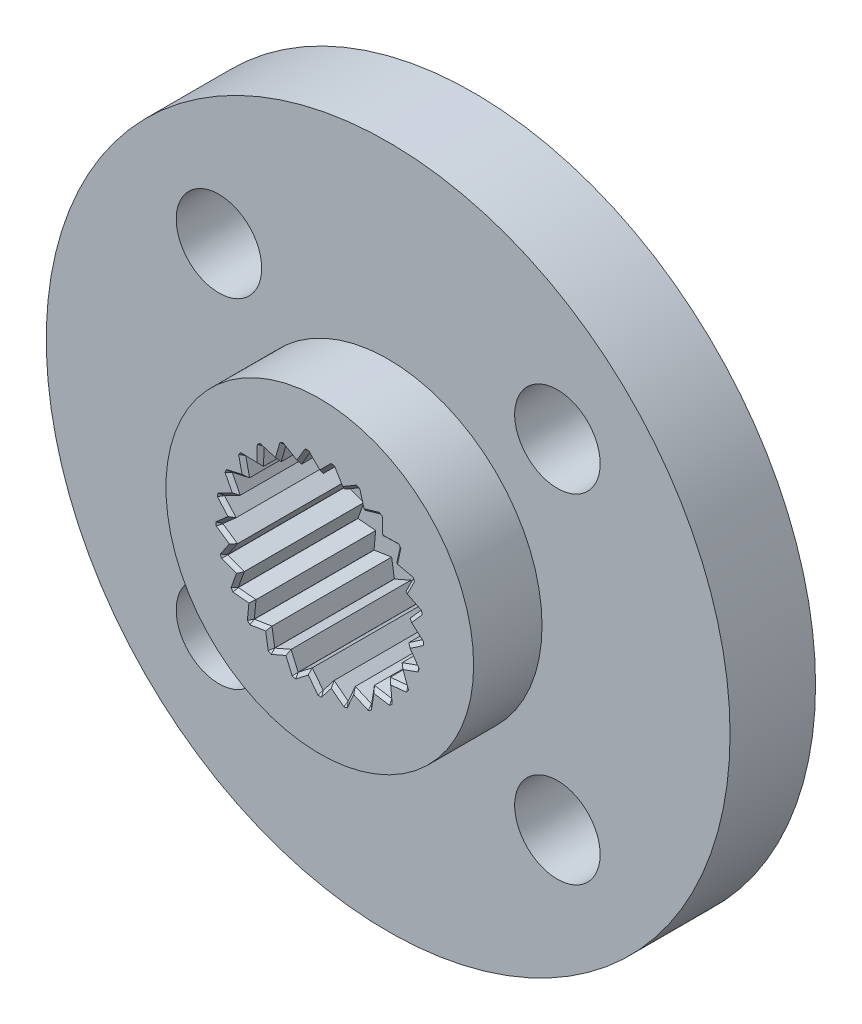
from build123d import *

# Parameters (mm, degrees)
SKETCH_1_R          = 10
SKETCH_1_R_2        = 1.25
SKETCH_1_R_3        = 1.5
EXTRUDE_1_DEPTH     = 2.5
SKETCH_2_R          = 4.5
SKETCH_2_R_2        = 1.5
EXTRUDE_2_DEPTH     = 2
CUT_EXTRUDE_START   = -3.6
SKETCH_3_R          = 1.5
CUT_EXTRUDE_1_DEPTH = 3.6
CHAMFER_1_SIZE      = 0.1


with BuildPart() as part:
    # 草图1 → 凸台-拉伸1 (new body)
    with BuildSketch(Plane.XY):
        Circle(SKETCH_1_R)
        with Locations((-4.949747468, 4.949747468)):
            Circle(SKETCH_1_R_2, mode=Mode.SUBTRACT)
        with Locations((4.949747468, 4.949747468)):
            Circle(SKETCH_1_R_2, mode=Mode.SUBTRACT)
        with Locations((4.949747468, -4.949747468)):
            Circle(SKETCH_1_R_2, mode=Mode.SUBTRACT)
        with Locations((-4.949747468, -4.949747468)):
            Circle(SKETCH_1_R_2, mode=Mode.SUBTRACT)
        Circle(SKETCH_1_R_3, mode=Mode.SUBTRACT)
    extrude(amount=EXTRUDE_1_DEPTH)

    # 草图2 → 凸台-拉伸2 (add)
    with BuildSketch(Plane.XY.offset(2.5)):
        Circle(SKETCH_2_R)
        Circle(SKETCH_2_R_2, mode=Mode.SUBTRACT)
    extrude(amount=EXTRUDE_2_DEPTH)

    # 草图3 → 切除-拉伸1 (cut)
    with BuildSketch(Plane.XY.offset(4.5).offset(CUT_EXTRUDE_START)):
        with BuildLine():
            Line((0.366495157, 2.916495157), (0, 2.55))
            Line((0, 2.55), (-0.366495157, 2.916495157))
            ThreePointArc((-0.366495157, 2.916495157), (-0.368408565, 2.916254075), (-0.370321814, 2.916011738))
            Line((-0.370321814, 2.916011738), (-0.634159212, 2.469887061))
            Line((-0.634159212, 2.469887061), (-1.080283889, 2.733724459))
            ThreePointArc((-1.080283889, 2.733724459), (-1.082077229, 2.733015106), (-1.083870103, 2.732304577))
            Line((-1.083870103, 2.732304577), (-1.228471869, 2.234582034))
            Line((-1.228471869, 2.234582034), (-1.726194412, 2.3791838))
            ThreePointArc((-1.726194412, 2.3791838), (-1.727755001, 2.378050747), (-1.729314848, 2.37691667))
            Line((-1.729314848, 2.37691667), (-1.74559512, 1.85887))
            Line((-1.74559512, 1.85887), (-2.263641791, 1.875150272))
            ThreePointArc((-2.263641791, 1.875150272), (-2.264871573, 1.873664714), (-2.26610038, 1.872178348))
            Line((-2.26610038, 1.872178348), (-2.15303621, 1.366358327))
            Line((-2.15303621, 1.366358327), (-2.658856231, 1.253294157))
            ThreePointArc((-2.658856231, 1.253294157), (-2.659677934, 1.251549435), (-2.660498492, 1.249804175))
            Line((-2.660498492, 1.249804175), (-2.425194117, 0.787993336))
            Line((-2.425194117, 0.787993336), (-2.887004956, 0.55268896))
            ThreePointArc((-2.887004956, 0.55268896), (-2.887366949, 0.550794703), (-2.887727699, 0.548900209))
            Line((-2.887727699, 0.548900209), (-2.544968157, 0.160115825))
            Line((-2.544968157, 0.160115825), (-2.933752541, -0.182643716))
            ThreePointArc((-2.933752541, -0.182643716), (-2.933632079, -0.184568486), (-2.933510354, -0.186493176))
            Line((-2.933510354, -0.186493176), (-2.504832489, -0.477822352))
            Line((-2.504832489, -0.477822352), (-2.796161665, -0.906500217))
            ThreePointArc((-2.796161665, -0.906500217), (-2.795566317, -0.908334558), (-2.794969765, -0.910168509))
            Line((-2.794969765, -0.910168509), (-2.307308984, -1.085737193))
            Line((-2.307308984, -1.085737193), (-2.482877668, -1.573397974))
            ThreePointArc((-2.482877668, -1.573397974), (-2.481844841, -1.57502663), (-2.480810946, -1.576654607))
            Line((-2.480810946, -1.576654607), (-1.964808769, -1.625431174))
            Line((-1.964808769, -1.625431174), (-2.013585336, -2.141433351))
            ThreePointArc((-2.013585336, -2.141433351), (-2.012179927, -2.142753985), (-2.010773652, -2.144073698))
            Line((-2.010773652, -2.144073698), (-1.498852393, -2.062993336))
            Line((-1.498852393, -2.062993336), (-1.417772031, -2.574914594))
            ThreePointArc((-1.417772031, -2.574914594), (-1.416082348, -2.575844228), (-1.414392054, -2.576772752))
            Line((-1.414392054, -2.576772752), (-0.938717609, -2.370930039))
            Line((-0.938717609, -2.370930039), (-0.732874896, -2.846604484))
            ThreePointArc((-0.732874896, -2.846604484), (-0.731007106, -2.847084704), (-0.729139002, -2.847563698))
            Line((-0.729139002, -2.847563698), (-0.319599746, -2.529892488))
            Line((-0.319599746, -2.529892488), (-0.001928536, -2.939431745))
            ThreePointArc((-0.001928536, -2.939431745), (0, -2.939432377), (0.001928536, -2.939431745))
            Line((0.001928536, -2.939431745), (0.319599746, -2.529892488))
            Line((0.319599746, -2.529892488), (0.729139002, -2.847563698))
            ThreePointArc((0.729139002, -2.847563698), (0.731007106, -2.847084704), (0.732874896, -2.846604484))
            Line((0.732874896, -2.846604484), (0.938717609, -2.370930039))
            Line((0.938717609, -2.370930039), (1.414392054, -2.576772752))
            ThreePointArc((1.414392054, -2.576772752), (1.416082348, -2.575844228), (1.417772031, -2.574914594))
            Line((1.417772031, -2.574914594), (1.498852393, -2.062993336))
            Line((1.498852393, -2.062993336), (2.010773652, -2.144073698))
            ThreePointArc((2.010773652, -2.144073698), (2.012179927, -2.142753985), (2.013585336, -2.141433351))
            Line((2.013585336, -2.141433351), (1.964808769, -1.625431174))
            Line((1.964808769, -1.625431174), (2.480810946, -1.576654607))
            ThreePointArc((2.480810946, -1.576654607), (2.481844841, -1.57502663), (2.482877668, -1.573397974))
            Line((2.482877668, -1.573397974), (2.307308984, -1.085737193))
            Line((2.307308984, -1.085737193), (2.794969765, -0.910168509))
            ThreePointArc((2.794969765, -0.910168509), (2.795566317, -0.908334558), (2.796161665, -0.906500217))
            Line((2.796161665, -0.906500217), (2.504832489, -0.477822352))
            Line((2.504832489, -0.477822352), (2.933510354, -0.186493176))
            ThreePointArc((2.933510354, -0.186493176), (2.933632079, -0.184568486), (2.933752541, -0.182643716))
            Line((2.933752541, -0.182643716), (2.544968157, 0.160115825))
            Line((2.544968157, 0.160115825), (2.887727699, 0.548900209))
            ThreePointArc((2.887727699, 0.548900209), (2.887366949, 0.550794703), (2.887004956, 0.55268896))
            Line((2.887004956, 0.55268896), (2.425194117, 0.787993336))
            Line((2.425194117, 0.787993336), (2.660498492, 1.249804175))
            ThreePointArc((2.660498492, 1.249804175), (2.659677934, 1.251549435), (2.658856231, 1.253294157))
            Line((2.658856231, 1.253294157), (2.15303621, 1.366358327))
            Line((2.15303621, 1.366358327), (2.26610038, 1.872178348))
            ThreePointArc((2.26610038, 1.872178348), (2.264871573, 1.873664714), (2.263641791, 1.875150272))
            Line((2.263641791, 1.875150272), (1.74559512, 1.85887))
            Line((1.74559512, 1.85887), (1.729314848, 2.37691667))
            ThreePointArc((1.729314848, 2.37691667), (1.727755001, 2.378050747), (1.726194412, 2.3791838))
            Line((1.726194412, 2.3791838), (1.228471869, 2.234582034))
            Line((1.228471869, 2.234582034), (1.083870103, 2.732304577))
            ThreePointArc((1.083870103, 2.732304577), (1.082077229, 2.733015106), (1.080283889, 2.733724459))
            Line((1.080283889, 2.733724459), (0.634159212, 2.469887061))
            Line((0.634159212, 2.469887061), (0.370321814, 2.916011738))
            ThreePointArc((0.370321814, 2.916011738), (0.368408565, 2.916254075), (0.366495157, 2.916495157))
        make_face()
        Circle(SKETCH_3_R, mode=Mode.SUBTRACT)
    extrude(amount=CUT_EXTRUDE_1_DEPTH, mode=Mode.SUBTRACT)

    # 倒角1
    chamfer_1_edges = [part.edges().sort_by_distance(p)[0] for p in [
        (-2.719171422, -0.332157764, 4.5),
    ]]
    chamfer(chamfer_1_edges, length=CHAMFER_1_SIZE)
    chamfer_1_2_edges = [part.edges().sort_by_distance(p)[0] for p in [
        (-2.678601246, -0.733515313, 4.5),
    ]]
    chamfer(chamfer_1_2_edges, length=CHAMFER_1_SIZE)
    chamfer_1_3_edges = [part.edges().sort_by_distance(p)[0] for p in [
        (-2.551139374, -0.997952851, 4.5),
    ]]
    chamfer(chamfer_1_3_edges, length=CHAMFER_1_SIZE)
    chamfer_1_4_edges = [part.edges().sort_by_distance(p)[0] for p in [
        (-2.412030222, -1.376611622, 4.5),
    ]]
    chamfer(chamfer_1_4_edges, length=CHAMFER_1_SIZE)
    chamfer_1_5_edges = [part.edges().sort_by_distance(p)[0] for p in [
        (-2.222809858, -1.601042891, 4.5),
    ]]
    chamfer(chamfer_1_5_edges, length=CHAMFER_1_SIZE)
    chamfer_1_6_edges = [part.edges().sort_by_distance(p)[0] for p in [
        (-1.993902468, -1.933210361, 4.5),
    ]]
    chamfer(chamfer_1_6_edges, length=CHAMFER_1_SIZE)
    chamfer_1_7_edges = [part.edges().sort_by_distance(p)[0] for p in [
        (-1.754813023, -2.103533517, 4.5),
    ]]
    chamfer(chamfer_1_7_edges, length=CHAMFER_1_SIZE)
    chamfer_1_8_edges = [part.edges().sort_by_distance(p)[0] for p in [
        (-1.450490489, -2.368338382, 4.5),
    ]]
    chamfer(chamfer_1_8_edges, length=CHAMFER_1_SIZE)
    chamfer_1_9_edges = [part.edges().sort_by_distance(p)[0] for p in [
        (-1.176554832, -2.473851396, 4.5),
    ]]
    chamfer(chamfer_1_9_edges, length=CHAMFER_1_SIZE)
    chamfer_1_10_edges = [part.edges().sort_by_distance(p)[0] for p in [
        (-0.815938858, -2.654654993, 4.5),
    ]]
    chamfer(chamfer_1_10_edges, length=CHAMFER_1_SIZE)
    chamfer_1_11_edges = [part.edges().sort_by_distance(p)[0] for p in [
        (-0.524369374, -2.688728093, 4.5),
    ]]
    chamfer(chamfer_1_11_edges, length=CHAMFER_1_SIZE)
    chamfer_1_12_edges = [part.edges().sort_by_distance(p)[0] for p in [
        (-0.130118788, -2.774169867, 4.5),
    ]]
    chamfer(chamfer_1_12_edges, length=CHAMFER_1_SIZE)
    chamfer_1_13_edges = [part.edges().sort_by_distance(p)[0] for p in [
        (0.160764141, -2.734662116, 4.5),
    ]]
    chamfer(chamfer_1_13_edges, length=CHAMFER_1_SIZE)
    chamfer_1_14_edges = [part.edges().sort_by_distance(p)[0] for p in [
        (0.563877124, -2.719373446, 4.5),
    ]]
    chamfer(chamfer_1_14_edges, length=CHAMFER_1_SIZE)
    chamfer_1_15_edges = [part.edges().sort_by_distance(p)[0] for p in [
        (0.835796253, -2.608767261, 4.5),
    ]]
    chamfer(chamfer_1_15_edges, length=CHAMFER_1_SIZE)
    chamfer_1_16_edges = [part.edges().sort_by_distance(p)[0] for p in [
        (1.222442563, -2.49370879, 4.5),
    ]]
    chamfer(chamfer_1_16_edges, length=CHAMFER_1_SIZE)
    chamfer_1_17_edges = [part.edges().sort_by_distance(p)[0] for p in [
        (1.458312212, -2.318953965, 4.5),
    ]]
    chamfer(chamfer_1_17_edges, length=CHAMFER_1_SIZE)
    chamfer_1_18_edges = [part.edges().sort_by_distance(p)[0] for p in [
        (1.80419744, -2.11135524, 4.5),
    ]]
    chamfer(chamfer_1_18_edges, length=CHAMFER_1_SIZE)
    chamfer_1_19_edges = [part.edges().sort_by_distance(p)[0] for p in [
        (1.989197052, -1.883432262, 4.5),
    ]]
    chamfer(chamfer_1_19_edges, length=CHAMFER_1_SIZE)
    chamfer_1_20_edges = [part.edges().sort_by_distance(p)[0] for p in [
        (2.272587956, -1.596337475, 4.5),
    ]]
    chamfer(chamfer_1_20_edges, length=CHAMFER_1_SIZE)
    chamfer_1_21_edges = [part.edges().sort_by_distance(p)[0] for p in [
        (2.395093326, -1.329567584, 4.5),
    ]]
    chamfer(chamfer_1_21_edges, length=CHAMFER_1_SIZE)
    chamfer_1_22_edges = [part.edges().sort_by_distance(p)[0] for p in [
        (2.598183413, -0.981015955, 4.5),
    ]]
    chamfer(chamfer_1_22_edges, length=CHAMFER_1_SIZE)
    chamfer_1_23_edges = [part.edges().sort_by_distance(p)[0] for p in [
        (2.650497077, -0.692161284, 4.5),
    ]]
    chamfer(chamfer_1_23_edges, length=CHAMFER_1_SIZE)
    chamfer_1_24_edges = [part.edges().sort_by_distance(p)[0] for p in [
        (2.76052545, -0.304053595, 4.5),
    ]]
    chamfer(chamfer_1_24_edges, length=CHAMFER_1_SIZE)
    chamfer_1_25_edges = [part.edges().sort_by_distance(p)[0] for p in [
        (2.739360349, -0.011263946, 4.5),
    ]]
    chamfer(chamfer_1_25_edges, length=CHAMFER_1_SIZE)
    chamfer_1_26_edges = [part.edges().sort_by_distance(p)[0] for p in [
        (2.749413521, 0.39201357, 4.5),
    ]]
    chamfer(chamfer_1_26_edges, length=CHAMFER_1_SIZE)
    chamfer_1_27_edges = [part.edges().sort_by_distance(p)[0] for p in [
        (2.656099536, 0.670341148, 4.5),
    ]]
    chamfer(chamfer_1_27_edges, length=CHAMFER_1_SIZE)
    chamfer_1_28_edges = [part.edges().sort_by_distance(p)[0] for p in [
        (2.565545829, 1.063449081, 4.5),
    ]]
    chamfer(chamfer_1_28_edges, length=CHAMFER_1_SIZE)
    chamfer_1_29_edges = [part.edges().sort_by_distance(p)[0] for p in [
        (2.40594622, 1.309826242, 4.5),
    ]]
    chamfer(chamfer_1_29_edges, length=CHAMFER_1_SIZE)
    chamfer_1_30_edges = [part.edges().sort_by_distance(p)[0] for p in [
        (2.220475457, 1.668064176, 4.5),
    ]]
    chamfer(chamfer_1_30_edges, length=CHAMFER_1_SIZE)
    chamfer_1_31_edges = [part.edges().sort_by_distance(p)[0] for p in [
        (2.004618455, 1.867010136, 4.5),
    ]]
    chamfer(chamfer_1_31_edges, length=CHAMFER_1_SIZE)
    chamfer_1_32_edges = [part.edges().sort_by_distance(p)[0] for p in [
        (1.735884446, 2.167868663, 4.5),
    ]]
    chamfer(chamfer_1_32_edges, length=CHAMFER_1_SIZE)
    chamfer_1_33_edges = [part.edges().sort_by_distance(p)[0] for p in [
        (1.47733314, 2.306882917, 4.5),
    ]]
    chamfer(chamfer_1_33_edges, length=CHAMFER_1_SIZE)
    chamfer_1_34_edges = [part.edges().sort_by_distance(p)[0] for p in [
        (1.142221431, 2.53145799, 4.5),
    ]]
    chamfer(chamfer_1_34_edges, length=CHAMFER_1_SIZE)
    chamfer_1_35_edges = [part.edges().sort_by_distance(p)[0] for p in [
        (0.857221551, 2.60180576, 4.5),
    ]]
    chamfer(chamfer_1_35_edges, length=CHAMFER_1_SIZE)
    chamfer_1_36_edges = [part.edges().sort_by_distance(p)[0] for p in [
        (0.476788442, 2.735986501, 4.5),
    ]]
    chamfer(chamfer_1_36_edges, length=CHAMFER_1_SIZE)
    chamfer_1_37_edges = [part.edges().sort_by_distance(p)[0] for p in [
        (0.183247578, 2.733247578, 4.5),
    ]]
    chamfer(chamfer_1_37_edges, length=CHAMFER_1_SIZE)
    chamfer_1_38_edges = [part.edges().sort_by_distance(p)[0] for p in [
        (-0.218602918, 2.768602918, 4.5),
    ]]
    chamfer(chamfer_1_38_edges, length=CHAMFER_1_SIZE)
    chamfer_1_39_edges = [part.edges().sort_by_distance(p)[0] for p in [
        (-0.502240513, 2.692949399, 4.5),
    ]]
    chamfer(chamfer_1_39_edges, length=CHAMFER_1_SIZE)
    chamfer_1_40_edges = [part.edges().sort_by_distance(p)[0] for p in [
        (-0.900258652, 2.627257831, 4.5),
    ]]
    chamfer(chamfer_1_40_edges, length=CHAMFER_1_SIZE)
    chamfer_1_41_edges = [part.edges().sort_by_distance(p)[0] for p in [
        (-1.156170986, 2.483443305, 4.5),
    ]]
    chamfer(chamfer_1_41_edges, length=CHAMFER_1_SIZE)
    chamfer_1_42_edges = [part.edges().sort_by_distance(p)[0] for p in [
        (-1.525347825, 2.320832472, 4.5),
    ]]
    chamfer(chamfer_1_42_edges, length=CHAMFER_1_SIZE)
    chamfer_1_43_edges = [part.edges().sort_by_distance(p)[0] for p in [
        (-1.737454984, 2.117893335, 4.5),
    ]]
    chamfer(chamfer_1_43_edges, length=CHAMFER_1_SIZE)
    chamfer_1_44_edges = [part.edges().sort_by_distance(p)[0] for p in [
        (-2.054593783, 1.868580674, 4.5),
    ]]
    chamfer(chamfer_1_44_edges, length=CHAMFER_1_SIZE)
    chamfer_1_45_edges = [part.edges().sort_by_distance(p)[0] for p in [
        (-2.209568295, 1.619268338, 4.5),
    ]]
    chamfer(chamfer_1_45_edges, length=CHAMFER_1_SIZE)
    chamfer_1_46_edges = [part.edges().sort_by_distance(p)[0] for p in [
        (-2.454742059, 1.29891908, 4.5),
    ]]
    chamfer(chamfer_1_46_edges, length=CHAMFER_1_SIZE)
    chamfer_1_47_edges = [part.edges().sort_by_distance(p)[0] for p in [
        (-2.542846304, 1.018898755, 4.5),
    ]]
    chamfer(chamfer_1_47_edges, length=CHAMFER_1_SIZE)
    chamfer_1_48_edges = [part.edges().sort_by_distance(p)[0] for p in [
        (-2.700649862, 0.647641623, 4.5),
    ]]
    chamfer(chamfer_1_48_edges, length=CHAMFER_1_SIZE)
    chamfer_1_49_edges = [part.edges().sort_by_distance(p)[0] for p in [
        (-2.716347928, 0.354508017, 4.5),
    ]]
    chamfer(chamfer_1_49_edges, length=CHAMFER_1_SIZE)
    chamfer_1_50_edges = [part.edges().sort_by_distance(p)[0] for p in [
        (-2.776865903, -0.044329539, 4.5),
    ]]
    chamfer(chamfer_1_50_edges, length=CHAMFER_1_SIZE)
    chamfer_1_51_edges = [part.edges().sort_by_distance(p)[0] for p in [
        (-2.933632079, -0.184568486, 4.5),
    ]]
    chamfer(chamfer_1_51_edges, length=CHAMFER_1_SIZE)
    chamfer_1_52_edges = [part.edges().sort_by_distance(p)[0] for p in [
        (-2.795566317, -0.908334558, 4.5),
    ]]
    chamfer(chamfer_1_52_edges, length=CHAMFER_1_SIZE - 0.0001)  # a hair under: the kernel refuses the full size
    chamfer_1_53_edges = [part.edges().sort_by_distance(p)[0] for p in [
        (-2.481844841, -1.57502663, 4.5),
    ]]
    chamfer(chamfer_1_53_edges, length=CHAMFER_1_SIZE)
    chamfer_1_54_edges = [part.edges().sort_by_distance(p)[0] for p in [
        (-2.012179927, -2.142753985, 4.5),
    ]]
    chamfer(chamfer_1_54_edges, length=CHAMFER_1_SIZE - 0.0001)  # a hair under: the kernel refuses the full size
    chamfer_1_55_edges = [part.edges().sort_by_distance(p)[0] for p in [
        (-1.416082348, -2.575844228, 4.5),
    ]]
    chamfer(chamfer_1_55_edges, length=CHAMFER_1_SIZE - 0.0001)  # a hair under: the kernel refuses the full size
    chamfer_1_56_edges = [part.edges().sort_by_distance(p)[0] for p in [
        (-0.731007106, -2.847084704, 4.5),
    ]]
    chamfer(chamfer_1_56_edges, length=CHAMFER_1_SIZE - 0.0001)  # a hair under: the kernel refuses the full size
    chamfer_1_57_edges = [part.edges().sort_by_distance(p)[0] for p in [
        (0, -2.939432377, 4.5),
    ]]
    chamfer(chamfer_1_57_edges, length=CHAMFER_1_SIZE - 0.0001)  # a hair under: the kernel refuses the full size
    chamfer_1_58_edges = [part.edges().sort_by_distance(p)[0] for p in [
        (0.731007106, -2.847084704, 4.5),
    ]]
    chamfer(chamfer_1_58_edges, length=CHAMFER_1_SIZE)
    chamfer_1_59_edges = [part.edges().sort_by_distance(p)[0] for p in [
        (1.416082348, -2.575844228, 4.5),
    ]]
    chamfer(chamfer_1_59_edges, length=CHAMFER_1_SIZE)
    chamfer_1_60_edges = [part.edges().sort_by_distance(p)[0] for p in [
        (2.012179927, -2.142753985, 4.5),
    ]]
    chamfer(chamfer_1_60_edges, length=CHAMFER_1_SIZE - 0.0001)  # a hair under: the kernel refuses the full size
    chamfer_1_61_edges = [part.edges().sort_by_distance(p)[0] for p in [
        (2.481844841, -1.57502663, 4.5),
    ]]
    chamfer(chamfer_1_61_edges, length=CHAMFER_1_SIZE)
    chamfer_1_62_edges = [part.edges().sort_by_distance(p)[0] for p in [
        (2.795566317, -0.908334558, 4.5),
    ]]
    chamfer(chamfer_1_62_edges, length=CHAMFER_1_SIZE - 0.0001)  # a hair under: the kernel refuses the full size
    chamfer_1_63_edges = [part.edges().sort_by_distance(p)[0] for p in [
        (2.933632079, -0.184568486, 4.5),
    ]]
    chamfer(chamfer_1_63_edges, length=CHAMFER_1_SIZE - 0.0001)  # a hair under: the kernel refuses the full size
    chamfer_1_64_edges = [part.edges().sort_by_distance(p)[0] for p in [
        (2.887366949, 0.550794703, 4.5),
    ]]
    chamfer(chamfer_1_64_edges, length=CHAMFER_1_SIZE)
    chamfer_1_65_edges = [part.edges().sort_by_distance(p)[0] for p in [
        (2.659677934, 1.251549435, 4.5),
    ]]
    chamfer(chamfer_1_65_edges, length=CHAMFER_1_SIZE - 0.0001)  # a hair under: the kernel refuses the full size
    chamfer_1_66_edges = [part.edges().sort_by_distance(p)[0] for p in [
        (2.264871573, 1.873664714, 4.5),
    ]]
    chamfer(chamfer_1_66_edges, length=CHAMFER_1_SIZE - 0.0001)  # a hair under: the kernel refuses the full size
    chamfer_1_67_edges = [part.edges().sort_by_distance(p)[0] for p in [
        (1.727755001, 2.378050747, 4.5),
    ]]
    chamfer(chamfer_1_67_edges, length=CHAMFER_1_SIZE - 0.0001)  # a hair under: the kernel refuses the full size
    chamfer_1_68_edges = [part.edges().sort_by_distance(p)[0] for p in [
        (1.082077229, 2.733015106, 4.5),
    ]]
    chamfer(chamfer_1_68_edges, length=CHAMFER_1_SIZE - 0.0001)  # a hair under: the kernel refuses the full size
    chamfer_1_69_edges = [part.edges().sort_by_distance(p)[0] for p in [
        (0.368408565, 2.916254075, 4.5),
    ]]
    chamfer(chamfer_1_69_edges, length=CHAMFER_1_SIZE - 0.0001)  # a hair under: the kernel refuses the full size
    chamfer_1_70_edges = [part.edges().sort_by_distance(p)[0] for p in [
        (-0.368408565, 2.916254075, 4.5),
    ]]
    chamfer(chamfer_1_70_edges, length=CHAMFER_1_SIZE - 0.0001)  # a hair under: the kernel refuses the full size
    chamfer_1_71_edges = [part.edges().sort_by_distance(p)[0] for p in [
        (-1.082077229, 2.733015106, 4.5),
    ]]
    chamfer(chamfer_1_71_edges, length=CHAMFER_1_SIZE - 0.0001)  # a hair under: the kernel refuses the full size
    chamfer_1_72_edges = [part.edges().sort_by_distance(p)[0] for p in [
        (-1.727755001, 2.378050747, 4.5),
    ]]
    chamfer(chamfer_1_72_edges, length=CHAMFER_1_SIZE)
    chamfer_1_73_edges = [part.edges().sort_by_distance(p)[0] for p in [
        (-2.264871573, 1.873664714, 4.5),
    ]]
    chamfer(chamfer_1_73_edges, length=CHAMFER_1_SIZE - 0.0001)  # a hair under: the kernel refuses the full size
    chamfer_1_74_edges = [part.edges().sort_by_distance(p)[0] for p in [
        (-2.659677934, 1.251549435, 4.5),
    ]]
    chamfer(chamfer_1_74_edges, length=CHAMFER_1_SIZE)
    chamfer_1_75_edges = [part.edges().sort_by_distance(p)[0] for p in [
        (-2.887366949, 0.550794703, 4.5),
    ]]
    chamfer(chamfer_1_75_edges, length=CHAMFER_1_SIZE)


solid = part.part
